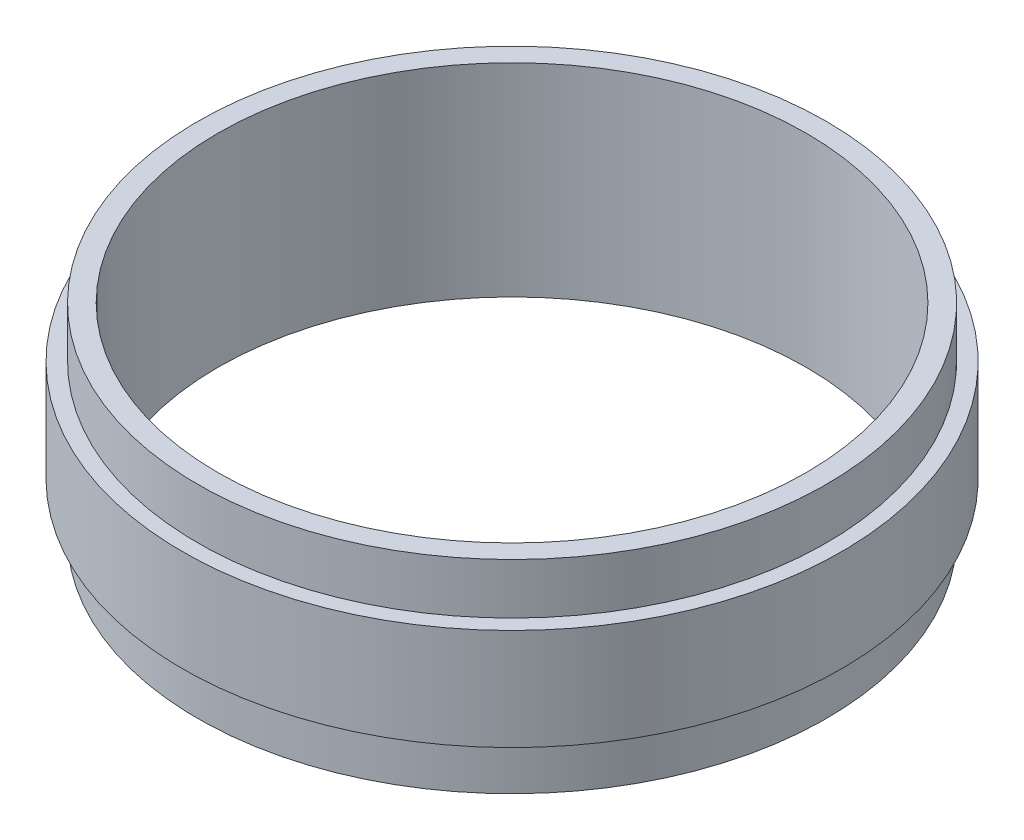
from build123d import *


with BuildPart() as part:
    # Szkic1 → Obrót1 (revolve)
    with BuildSketch(Plane.XY):
        Polygon((-62, 0), (-58, 0), (-58, 40), (-62, 40), (-62, 30), (-65, 30), (-65, 10), (-62, 10), align=None)
    revolve(axis=Axis((0, 0, 0), (0, 1, 0)))


solid = part.part
